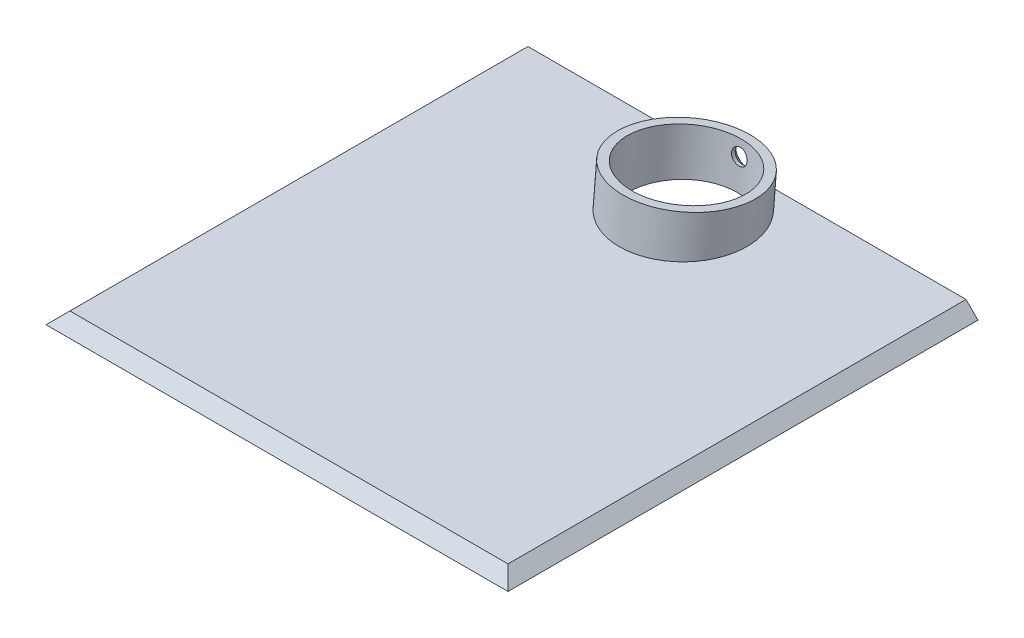
from build123d import *

# Parameters (mm, degrees)
SKETCH1_W                                      = 120
SKETCH1_H                                      = 120
BOSS_EXTRUDE1_DEPTH                            = 3
SKETCH2_R                                      = 16
BOSS_EXTRUDE2_DEPTH                            = 8
BOSS_EXTRUDE2_DIRECTION_2_REACH                = 122.252
SKETCH3_R                                      = 13.75
CUT_EXTRUDE1_DEPTH                             = 122.407232036
CHAMFER1_SIZE                                  = 5
CSK_FOR_5_FLAT_HEAD_MACHINE_SCREW2_D           = 3.9116
CSK_FOR_5_FLAT_HEAD_MACHINE_SCREW2_DEPTH       = 10.1
CSK_FOR_5_FLAT_HEAD_MACHINE_SCREW2_CSINK_D     = 6.4008
CSK_FOR_5_FLAT_HEAD_MACHINE_SCREW2_CSINK_ANGLE = 82
CSK_FOR_5_FLAT_HEAD_MACHINE_SCREW2_TIP         = 1.175163199


with BuildPart() as part:
    # Sketch1 → Boss-Extrude1 (new body)
    with BuildSketch(Plane(origin=(0, 0, 0), x_dir=(1, 0, 0), z_dir=(0, 1, 0))):
        with Locations((0, -44)):
            Rectangle(SKETCH1_W, SKETCH1_H)
    extrude(amount=-BOSS_EXTRUDE1_DEPTH)

    # Sketch2 → Boss-Extrude2 (add)
    with BuildSketch(Plane(origin=(0, 1.389185421, -0.121537976), x_dir=(-1, 0, 0), z_dir=(0, 0.9961946980917455, -0.08715574274765836))):
        with Locations(Location((0, 0, 0), (0, 0, 90))):
            Circle(SKETCH2_R)
    extrude(amount=BOSS_EXTRUDE2_DEPTH)

    # Boss-Extrude2 direction 2: up to this face of the body (flat: up to its plane)
    boss_extrude2_direction_2_end = Plane(part.part.faces().sort_by_distance((0, 0, 44))[0])
    # Sketch2 → Boss-Extrude2 direction 2 (add, up to the picked face)
    with BuildSketch(Plane(origin=(0, 1.389185421, -0.121537976), x_dir=(-1, 0, 0), z_dir=(0, 0.9961946980917455, -0.08715574274765836)), mode=Mode.PRIVATE) as boss_extrude2_direction_2_sk1:
        with Locations(Location((0, 0, 0), (0, 0, 90))):
            Circle(SKETCH2_R)
    boss_extrude2_direction_2_tool1 = split(extrude(boss_extrude2_direction_2_sk1.sketch, amount=-BOSS_EXTRUDE2_DIRECTION_2_REACH, mode=Mode.PRIVATE), bisect_by=boss_extrude2_direction_2_end, keep=Keep.BOTH, mode=Mode.PRIVATE)
    add(boss_extrude2_direction_2_tool1.solids().sort_by(Axis((0, 1.389185, -0.121538), (0, -0.9961946980917455, 0.08715574274765836)))[0])

    # Sketch3 → Cut-Extrude1 (cut, through all)
    with BuildSketch(Plane(origin=(0, 9.358743006, -0.818783918), x_dir=(1, 0, 0), z_dir=(0, 0.9961946980917457, -0.08715574274765836))):
        with Locations(Location((0, 0, 0), (0, 0, 270))):
            Circle(SKETCH3_R)
    extrude(amount=-CUT_EXTRUDE1_DEPTH, mode=Mode.SUBTRACT)

    # Chamfer1
    # the kernel refuses this chamfer: 5 mm, written as the material it takes off along each edge
    with BuildSketch(Plane(origin=(60, 0, -28.85841494), x_dir=(-0.9996219169112968, 0.027495876610586372, 0), z_dir=(0, 0, 1)), Plane(origin=(72.85841494, 0, 104), x_dir=(0, 0.027495876610586334, -0.9996219169112968), z_dir=(-1, 0, 0)), Plane(origin=(-60, 0, 116.85841494), x_dir=(0.9996219169112968, 0.027495876610586372, 0), z_dir=(0, 0, -1))) as chamfer1_piece_1:
        Polygon((CHAMFER1_SIZE * 0.999621916911, CHAMFER1_SIZE * 0.0274958766106), (-CHAMFER1_SIZE * 0.0274958766106, CHAMFER1_SIZE * 0.999621916911), (0, 0), align=None)
    extrude(amount=145.71682988, mode=Mode.SUBTRACT)

    # CSK for #5 Flat Head Machine Screw2
    with Locations(Plane(origin=(0, 4.243645214, -16.432388249), x_dir=(0, -0.996194698092, 0.087155742748), z_dir=(0, -0.087155742748, -0.996194698092))):
        with Locations((0, 0)):
            CounterSinkHole(CSK_FOR_5_FLAT_HEAD_MACHINE_SCREW2_D / 2, CSK_FOR_5_FLAT_HEAD_MACHINE_SCREW2_CSINK_D / 2, depth=CSK_FOR_5_FLAT_HEAD_MACHINE_SCREW2_DEPTH, counter_sink_angle=CSK_FOR_5_FLAT_HEAD_MACHINE_SCREW2_CSINK_ANGLE)
            with Locations((0, 0, -(CSK_FOR_5_FLAT_HEAD_MACHINE_SCREW2_DEPTH + CSK_FOR_5_FLAT_HEAD_MACHINE_SCREW2_TIP / 2))):  # 118° drill point
                Cone(0, CSK_FOR_5_FLAT_HEAD_MACHINE_SCREW2_D / 2, CSK_FOR_5_FLAT_HEAD_MACHINE_SCREW2_TIP, mode=Mode.SUBTRACT)


solid = part.part
